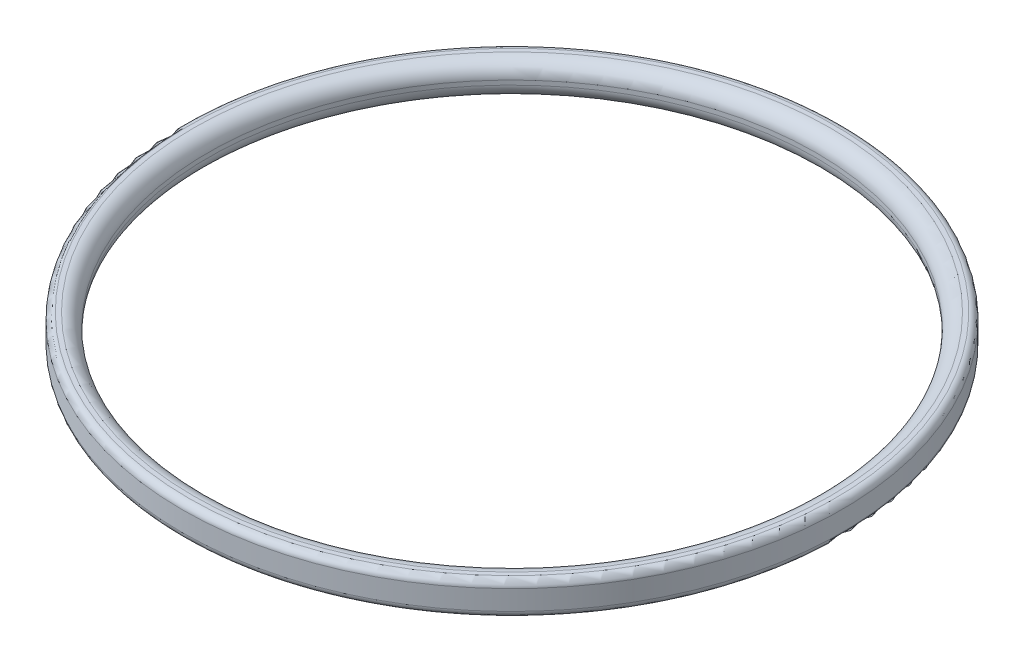
from build123d import *

# Parameters (mm, degrees)
SKETCH2_W = 2.921
SKETCH2_H = 3.81
FILLET1_R = 1.651
FILLET3_R = 0.762


with BuildPart() as part:
    # Sketch2 → Revolve1 (revolve)
    with BuildSketch(Plane.XY):
        with Locations((36.6395, 1.905)):
            Rectangle(SKETCH2_W, SKETCH2_H)
    revolve(axis=Axis((0, -55, 0), (0, 1, 0)))

    # Fillet1
    fillet1_edges = [part.edges().sort_by_distance(p)[0] for p in [
        (-35.179, 0, 0),
        (-35.179, 3.81, 0),
    ]]
    fillet(fillet1_edges, radius=FILLET1_R)

    # Fillet3
    fillet3_edges = [part.edges().sort_by_distance(p)[0] for p in [
        (-38.1, 0, 0),
        (-38.1, 3.81, 0),
    ]]
    fillet(fillet3_edges, radius=FILLET3_R)


solid = part.part
